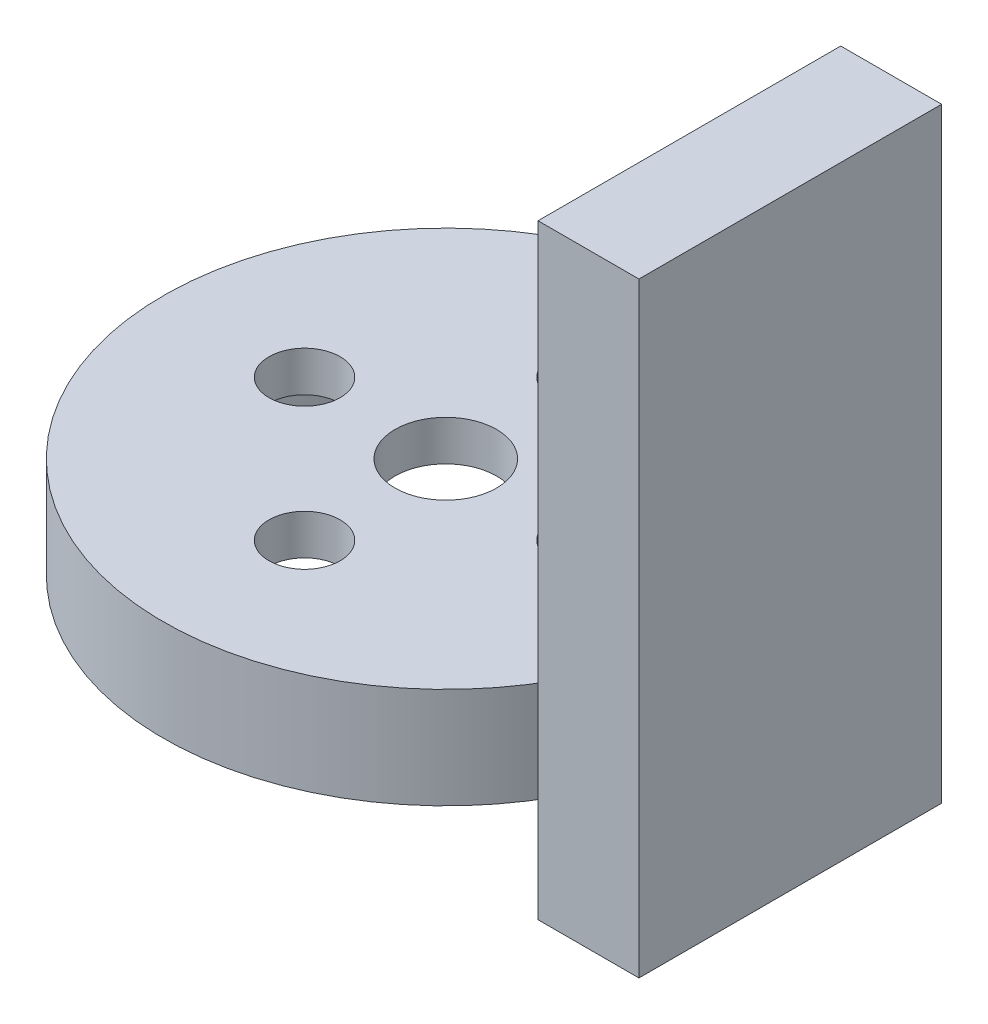
from build123d import *

# Parameters (mm, degrees)
SKETCH1_R           = 14
SKETCH1_R_2         = 2.517260593
SKETCH1_R_3         = 1.762082415
BOSS_EXTRUDE1_DEPTH = 5
SKETCH4_W           = 12
SKETCH4_H           = 5
BOSS_EXTRUDE4_DEPTH = 5
SKETCH6_W           = 5
SKETCH6_H           = 15
BOSS_EXTRUDE5_DEPTH = 30
SKETCH8_R           = 10.75
CUT_EXTRUDE2_DEPTH  = 3
FILLET1_R           = 5
FILLET2_R           = 1


with BuildPart() as part:
    # Sketch1 → Boss-Extrude1 (new body)
    with BuildSketch(Plane(origin=(0, 0, 0), x_dir=(1, 0, 0), z_dir=(0, 1, 0))):
        with Locations(Location((0, 0, 0), (0, 0, 270))):
            Circle(SKETCH1_R)
        with Locations(Location((0, 0, 0), (0, 0, 270))):
            Circle(SKETCH1_R_2, mode=Mode.SUBTRACT)
        with Locations(Location((0, 7, 0), (0, 0, 270))):
            Circle(SKETCH1_R_3, mode=Mode.SUBTRACT)
        with Locations(Location((7, 0, 0), (0, 0, 270))):
            Circle(SKETCH1_R_3, mode=Mode.SUBTRACT)
        with Locations(Location((0, -7, 0), (0, 0, 270))):
            Circle(SKETCH1_R_3, mode=Mode.SUBTRACT)
        with Locations(Location((-7, 0, 0), (0, 0, 270))):
            Circle(SKETCH1_R_3, mode=Mode.SUBTRACT)
    extrude(amount=BOSS_EXTRUDE1_DEPTH)

    # Sketch4 → Boss-Extrude4 (add)
    with BuildSketch(Plane(origin=(0, 5, 0), x_dir=(1, 0, 0), z_dir=(0, 1, 0))):
        with Locations((16.071494653, 0)):
            Rectangle(SKETCH4_W, SKETCH4_H)
    extrude(amount=-BOSS_EXTRUDE4_DEPTH)

    # Sketch6 → Boss-Extrude5 (add)
    with BuildSketch(Plane.XZ):
        with Locations((19.571494653, 5)):
            Rectangle(SKETCH6_W, SKETCH6_H)
    extrude(amount=-BOSS_EXTRUDE5_DEPTH)

    # Sketch8 → Cut-Extrude2 (cut)
    with BuildSketch(Plane.XZ):
        with Locations(Location((0, 0, 0), (0, 0, 270))):
            Circle(SKETCH8_R)
    extrude(amount=-CUT_EXTRUDE2_DEPTH, mode=Mode.SUBTRACT)

    # Fillet1
    # the kernel refuses this fillet: 5 mm, written as the material it adds along each edge
    with BuildSketch(Plane(origin=(17.071494653, 5, 2.5), x_dir=(-1, 0, 0), z_dir=(0, -1, 0))) as fillet1_piece_1:
        with BuildLine():
            CenterArc((5, -4.700866603), FILLET1_R, 109.919316249, 70.080683751)
            Line((0, -4.700866603), (-0.1, -4.700866603))
            Line((-0.1, -4.700866603), (-0.1, 0))
            Line((-0.1, 0), (0, 0.1))
            ThreePointArc((0, 0.1), (1.648258669, 0.1), (3.262447686, 0.094017332))
            Line((3.262447686, 0.094017332), (3.296517339, 0))
        make_face()
    extrude(amount=5)

    # Fillet2
    fillet2_edges = [part.edges().sort_by_distance(p)[0] for p in [
        (13.774977314, 2.5, 2.5),
        (13.774977314, 2.5, -2.5),
    ]]
    fillet(fillet2_edges, radius=FILLET2_R)


solid = part.part
